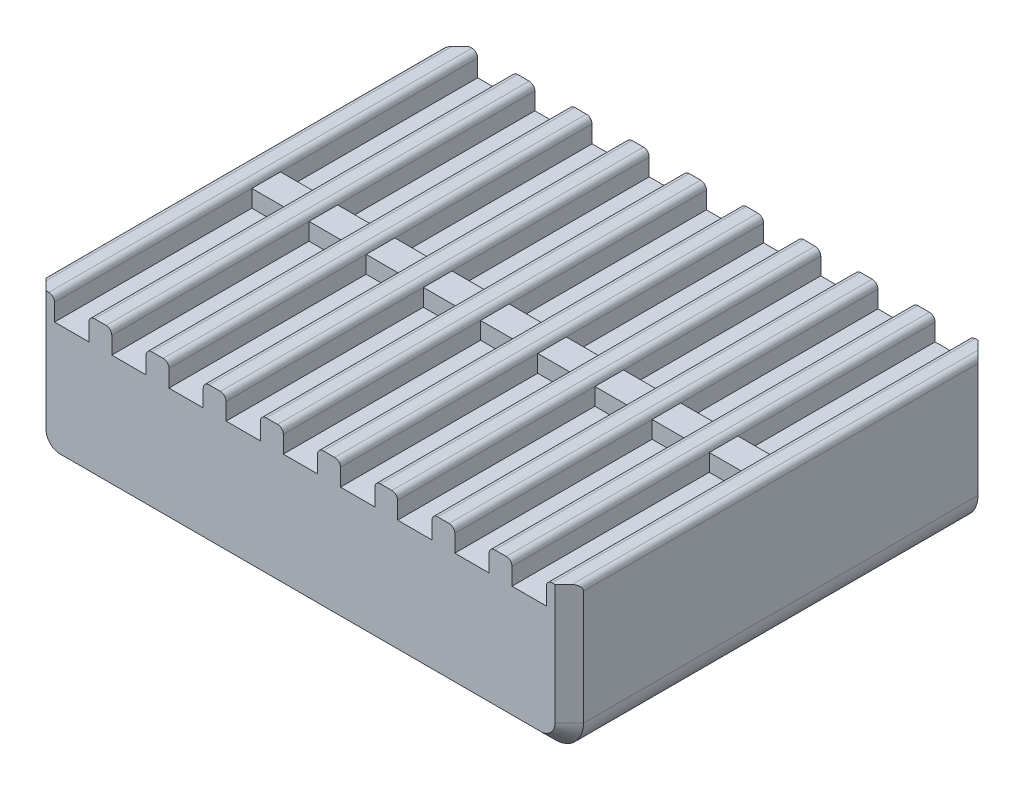
from build123d import *

# Parameters (mm, degrees)
SKETCH1_W           = 18.8
SKETCH1_H           = 14.8
BOSS_EXTRUDE1_DEPTH = 5.2
SKETCH2_W           = 1.2
SKETCH2_H           = 0.8
CUT_EXTRUDE1_DEPTH  = 19.287700785
SKETCH3_W           = 1.2
SKETCH3_H           = 0.8
CUT_EXTRUDE2_DEPTH  = 19.287700785
SKETCH4_W           = 1.2
SKETCH4_H           = 0.8
CUT_EXTRUDE3_DEPTH  = 19.287700785
SKETCH5_W           = 1.2
SKETCH5_H           = 0.8
CUT_EXTRUDE4_DEPTH  = 19.287700785
SKETCH6_W           = 1.2
SKETCH6_H           = 0.8
CUT_EXTRUDE5_DEPTH  = 19.287700785
SKETCH7_W           = 1.2
SKETCH7_H           = 0.8
CUT_EXTRUDE6_DEPTH  = 19.287700785
SKETCH8_W           = 1.2
SKETCH8_H           = 0.8
CUT_EXTRUDE7_DEPTH  = 19.287700785
SKETCH9_W           = 1.2
SKETCH9_H           = 0.8
CUT_EXTRUDE8_DEPTH  = 19.287700785
SKETCH10_W          = 1.2
SKETCH10_H          = 0.8
CUT_EXTRUDE9_DEPTH  = 19.287700785
RIB1_REACH          = 15.045
SKETCH11_WALL_W     = 29.289078174
SKETCH11_WALL_H     = 1
RIB2_REACH          = 15.045
SKETCH12_WALL_W     = 29.289078174
SKETCH12_WALL_H     = 1
RIB3_REACH          = 15.045
SKETCH13_WALL_W     = 29.289078174
SKETCH13_WALL_H     = 1
RIB4_REACH          = 15.045
SKETCH14_WALL_W     = 29.289078174
SKETCH14_WALL_H     = 1
RIB5_REACH          = 15.045
SKETCH15_WALL_W     = 29.289078174
SKETCH15_WALL_H     = 1
RIB6_REACH          = 15.045
SKETCH16_WALL_W     = 29.289078174
SKETCH16_WALL_H     = 1
RIB7_REACH          = 15.045
SKETCH17_WALL_W     = 29.289078174
SKETCH17_WALL_H     = 1
RIB8_REACH          = 15.045
SKETCH18_WALL_W     = 29.289078174
SKETCH18_WALL_H     = 1
RIB9_REACH          = 15.045
SKETCH19_WALL_W     = 29.289078174
SKETCH19_WALL_H     = 1
FILLET1_R           = 1
CHAMFER1_SIZE       = 0.5
FILLET2_START       = -8
FILLET2_DEPTH       = 16


with BuildPart() as part:
    # Sketch1 → Boss-Extrude1 (new body)
    with BuildSketch(Plane.XZ):
        Rectangle(SKETCH1_W, SKETCH1_H)
    extrude(amount=-BOSS_EXTRUDE1_DEPTH)

    # Sketch2 → Cut-Extrude1 (cut, through all)
    with BuildSketch(Plane(origin=(0, 0, -7.4), x_dir=(-1, 0, 0), z_dir=(0, 0, -1))):
        with Locations((-8, 4.8)):
            Rectangle(SKETCH2_W, SKETCH2_H)
    extrude(amount=-CUT_EXTRUDE1_DEPTH, mode=Mode.SUBTRACT)

    # Sketch3 → Cut-Extrude2 (cut, through all)
    with BuildSketch(Plane(origin=(0, 0, -7.4), x_dir=(-1, 0, 0), z_dir=(0, 0, -1))):
        with Locations((-6, 4.8)):
            Rectangle(SKETCH3_W, SKETCH3_H)
    extrude(amount=-CUT_EXTRUDE2_DEPTH, mode=Mode.SUBTRACT)

    # Sketch4 → Cut-Extrude3 (cut, through all)
    with BuildSketch(Plane(origin=(0, 0, -7.4), x_dir=(-1, 0, 0), z_dir=(0, 0, -1))):
        with Locations((-4, 4.8)):
            Rectangle(SKETCH4_W, SKETCH4_H)
    extrude(amount=-CUT_EXTRUDE3_DEPTH, mode=Mode.SUBTRACT)

    # Sketch5 → Cut-Extrude4 (cut, through all)
    with BuildSketch(Plane(origin=(0, 0, -7.4), x_dir=(-1, 0, 0), z_dir=(0, 0, -1))):
        with Locations((-2, 4.8)):
            Rectangle(SKETCH5_W, SKETCH5_H)
    extrude(amount=-CUT_EXTRUDE4_DEPTH, mode=Mode.SUBTRACT)

    # Sketch6 → Cut-Extrude5 (cut, through all)
    with BuildSketch(Plane(origin=(0, 0, -7.4), x_dir=(-1, 0, 0), z_dir=(0, 0, -1))):
        with Locations((0, 4.8)):
            Rectangle(SKETCH6_W, SKETCH6_H)
    extrude(amount=-CUT_EXTRUDE5_DEPTH, mode=Mode.SUBTRACT)

    # Sketch7 → Cut-Extrude6 (cut, through all)
    with BuildSketch(Plane(origin=(0, 0, -7.4), x_dir=(-1, 0, 0), z_dir=(0, 0, -1))):
        with Locations((2, 4.8)):
            Rectangle(SKETCH7_W, SKETCH7_H)
    extrude(amount=-CUT_EXTRUDE6_DEPTH, mode=Mode.SUBTRACT)

    # Sketch8 → Cut-Extrude7 (cut, through all)
    with BuildSketch(Plane(origin=(0, 0, -7.4), x_dir=(-1, 0, 0), z_dir=(0, 0, -1))):
        with Locations((4, 4.8)):
            Rectangle(SKETCH8_W, SKETCH8_H)
    extrude(amount=-CUT_EXTRUDE7_DEPTH, mode=Mode.SUBTRACT)

    # Sketch9 → Cut-Extrude8 (cut, through all)
    with BuildSketch(Plane(origin=(0, 0, -7.4), x_dir=(-1, 0, 0), z_dir=(0, 0, -1))):
        with Locations((6, 4.8)):
            Rectangle(SKETCH9_W, SKETCH9_H)
    extrude(amount=-CUT_EXTRUDE8_DEPTH, mode=Mode.SUBTRACT)

    # Sketch10 → Cut-Extrude9 (cut, through all)
    with BuildSketch(Plane(origin=(0, 0, -7.4), x_dir=(-1, 0, 0), z_dir=(0, 0, -1))):
        with Locations((8, 4.8)):
            Rectangle(SKETCH10_W, SKETCH10_H)
    extrude(amount=-CUT_EXTRUDE9_DEPTH, mode=Mode.SUBTRACT)

    # Sketch11 wall → Rib1 (add, up to next)
    with BuildSketch(Plane(origin=(4, 5, 0), x_dir=(1, 0, 0), z_dir=(0, -1, 0)), mode=Mode.PRIVATE) as rib1_sk1:
        Rectangle(SKETCH11_WALL_W, SKETCH11_WALL_H)
    rib1_tool1 = extrude(rib1_sk1.sketch, amount=RIB1_REACH, mode=Mode.PRIVATE) - part.part
    add(rib1_tool1.solids().sort_by_distance((4, 5, 0))[0])

    # Sketch12 wall → Rib2 (add, up to next)
    with BuildSketch(Plane(origin=(-4, 5, 0), x_dir=(1, 0, 0), z_dir=(0, -1, 0)), mode=Mode.PRIVATE) as rib2_sk1:
        Rectangle(SKETCH12_WALL_W, SKETCH12_WALL_H)
    rib2_tool1 = extrude(rib2_sk1.sketch, amount=RIB2_REACH, mode=Mode.PRIVATE) - part.part
    add(rib2_tool1.solids().sort_by_distance((-4, 5, 0))[0])

    # Sketch13 wall → Rib3 (add, up to next)
    with BuildSketch(Plane(origin=(-8, 5, 0), x_dir=(1, 0, 0), z_dir=(0, -1, 0)), mode=Mode.PRIVATE) as rib3_sk1:
        Rectangle(SKETCH13_WALL_W, SKETCH13_WALL_H)
    rib3_tool1 = extrude(rib3_sk1.sketch, amount=RIB3_REACH, mode=Mode.PRIVATE) - part.part
    add(rib3_tool1.solids().sort_by_distance((-8, 5, 0))[0])

    # Sketch14 wall → Rib4 (add, up to next)
    with BuildSketch(Plane(origin=(8, 5, 0), x_dir=(1, 0, 0), z_dir=(0, -1, 0)), mode=Mode.PRIVATE) as rib4_sk1:
        Rectangle(SKETCH14_WALL_W, SKETCH14_WALL_H)
    rib4_tool1 = extrude(rib4_sk1.sketch, amount=RIB4_REACH, mode=Mode.PRIVATE) - part.part
    add(rib4_tool1.solids().sort_by_distance((8, 5, 0))[0])

    # Sketch15 wall → Rib5 (add, up to next)
    with BuildSketch(Plane(origin=(2, 5, 0), x_dir=(1, 0, 0), z_dir=(0, -1, 0)), mode=Mode.PRIVATE) as rib5_sk1:
        Rectangle(SKETCH15_WALL_W, SKETCH15_WALL_H)
    rib5_tool1 = extrude(rib5_sk1.sketch, amount=RIB5_REACH, mode=Mode.PRIVATE) - part.part
    add(rib5_tool1.solids().sort_by_distance((2, 5, 0))[0])

    # Sketch16 wall → Rib6 (add, up to next)
    with BuildSketch(Plane(origin=(-2, 5, 0), x_dir=(1, 0, 0), z_dir=(0, -1, 0)), mode=Mode.PRIVATE) as rib6_sk1:
        Rectangle(SKETCH16_WALL_W, SKETCH16_WALL_H)
    rib6_tool1 = extrude(rib6_sk1.sketch, amount=RIB6_REACH, mode=Mode.PRIVATE) - part.part
    add(rib6_tool1.solids().sort_by_distance((-2, 5, 0))[0])

    # Sketch17 wall → Rib7 (add, up to next)
    with BuildSketch(Plane(origin=(6, 5, 0), x_dir=(1, 0, 0), z_dir=(0, -1, 0)), mode=Mode.PRIVATE) as rib7_sk1:
        Rectangle(SKETCH17_WALL_W, SKETCH17_WALL_H)
    rib7_tool1 = extrude(rib7_sk1.sketch, amount=RIB7_REACH, mode=Mode.PRIVATE) - part.part
    add(rib7_tool1.solids().sort_by_distance((6, 5, 0))[0])

    # Sketch18 wall → Rib8 (add, up to next)
    with BuildSketch(Plane.XZ.offset(-5), mode=Mode.PRIVATE) as rib8_sk1:
        Rectangle(SKETCH18_WALL_W, SKETCH18_WALL_H)
    rib8_tool1 = extrude(rib8_sk1.sketch, amount=RIB8_REACH, mode=Mode.PRIVATE) - part.part
    add(rib8_tool1.solids().sort_by_distance((0, 5, 0))[0])

    # Sketch19 wall → Rib9 (add, up to next)
    with BuildSketch(Plane(origin=(-6, 5, 0), x_dir=(1, 0, 0), z_dir=(0, -1, 0)), mode=Mode.PRIVATE) as rib9_sk1:
        Rectangle(SKETCH19_WALL_W, SKETCH19_WALL_H)
    rib9_tool1 = extrude(rib9_sk1.sketch, amount=RIB9_REACH, mode=Mode.PRIVATE) - part.part
    add(rib9_tool1.solids().sort_by_distance((-6, 5, 0))[0])

    # Fillet1
    fillet1_edges = [part.edges().sort_by_distance(p)[0] for p in [
        (9.4, 0, 0),
        (-9.4, 0, 0),
    ]]
    fillet(fillet1_edges, radius=FILLET1_R)

    # Chamfer1
    chamfer1_edges = [part.edges().sort_by_distance(p)[0] for p in [
        (-9.4, 3.1, 7.4),
        (9.4, 3.1, 7.4),
        (9.4, 3.1, -7.4),
        (-9.4, 3.1, -7.4),
        (0, 0, -7.4),
        (0, 0, 7.4),
        (-9.107106781, 0.292893219, 7.4),
        (9.107106781, 0.292893219, 7.4),
        (-9.107106781, 0.292893219, -7.4),
        (9.107106781, 0.292893219, -7.4),
    ]]
    chamfer(chamfer1_edges, length=CHAMFER1_SIZE)

    # Fillet2: read off the stored shape, not the designer's step
    # Fillet2 outline → Fillet2 (cut)
    with BuildSketch(Plane.XY.offset(FILLET2_START)):
        with BuildLine():
            Line((7.4, 5.2), (7.2, 5.2))
            ThreePointArc((7.2, 5.2), (7.341421356, 5.141421356), (7.4, 5))
            Line((7.4, 5), (7.4, 5.2))
        make_face()
        with BuildLine():
            ThreePointArc((6.6, 5), (6.658578644, 5.141421356), (6.8, 5.2))
            Line((6.8, 5.2), (6.6, 5.2))
            Line((6.6, 5.2), (6.6, 5))
        make_face()
        with BuildLine():
            Line((3.4, 5.2), (3.2, 5.2))
            ThreePointArc((3.2, 5.2), (3.341421356, 5.141421356), (3.4, 5))
            Line((3.4, 5), (3.4, 5.2))
        make_face()
        with BuildLine():
            ThreePointArc((2.6, 5), (2.658578644, 5.141421356), (2.8, 5.2))
            Line((2.8, 5.2), (2.6, 5.2))
            Line((2.6, 5.2), (2.6, 5))
        make_face()
        with BuildLine():
            Line((1.4, 5.2), (1.2, 5.2))
            ThreePointArc((1.2, 5.2), (1.341421356, 5.141421356), (1.4, 5))
            Line((1.4, 5), (1.4, 5.2))
        make_face()
        with BuildLine():
            ThreePointArc((0.6, 5), (0.658578644, 5.141421356), (0.8, 5.2))
            Line((0.8, 5.2), (0.6, 5.2))
            Line((0.6, 5.2), (0.6, 5))
        make_face()
        with BuildLine():
            Line((-7.4, 5.2), (-7.4, 5))
            ThreePointArc((-7.4, 5), (-7.341421356, 5.141421356), (-7.2, 5.2))
            Line((-7.2, 5.2), (-7.4, 5.2))
        make_face()
        with BuildLine():
            Line((-6.6, 5.2), (-6.8, 5.2))
            ThreePointArc((-6.8, 5.2), (-6.658578644, 5.141421356), (-6.6, 5))
            Line((-6.6, 5), (-6.6, 5.2))
        make_face()
        with BuildLine():
            Line((5.4, 5.2), (5.2, 5.2))
            ThreePointArc((5.2, 5.2), (5.341421356, 5.141421356), (5.4, 5))
            Line((5.4, 5), (5.4, 5.2))
        make_face()
        with BuildLine():
            ThreePointArc((4.6, 5), (4.658578644, 5.141421356), (4.8, 5.2))
            Line((4.8, 5.2), (4.6, 5.2))
            Line((4.6, 5.2), (4.6, 5))
        make_face()
        with BuildLine():
            Line((-8.6, 5.2), (-8.8, 5.2))
            ThreePointArc((-8.8, 5.2), (-8.658578644, 5.141421356), (-8.6, 5))
            Line((-8.6, 5), (-8.6, 5.2))
        make_face()
        with BuildLine():
            ThreePointArc((-9.4, 5), (-9.341421356, 5.141421356), (-9.2, 5.2))
            Line((-9.2, 5.2), (-9.4, 5.2))
            Line((-9.4, 5.2), (-9.4, 5))
        make_face()
        with BuildLine():
            Line((-5.4, 5.2), (-5.4, 5))
            ThreePointArc((-5.4, 5), (-5.341421356, 5.141421356), (-5.2, 5.2))
            Line((-5.2, 5.2), (-5.4, 5.2))
        make_face()
        with BuildLine():
            Line((-4.6, 5.2), (-4.8, 5.2))
            ThreePointArc((-4.8, 5.2), (-4.658578644, 5.141421356), (-4.6, 5))
            Line((-4.6, 5), (-4.6, 5.2))
        make_face()
        with BuildLine():
            Line((-3.4, 5.2), (-3.4, 5))
            ThreePointArc((-3.4, 5), (-3.341421356, 5.141421356), (-3.2, 5.2))
            Line((-3.2, 5.2), (-3.4, 5.2))
        make_face()
        with BuildLine():
            Line((-2.6, 5.2), (-2.8, 5.2))
            ThreePointArc((-2.8, 5.2), (-2.658578644, 5.141421356), (-2.6, 5))
            Line((-2.6, 5), (-2.6, 5.2))
        make_face()
        with BuildLine():
            Line((-1.4, 5.2), (-1.4, 5))
            ThreePointArc((-1.4, 5), (-1.341421356, 5.141421356), (-1.2, 5.2))
            Line((-1.2, 5.2), (-1.4, 5.2))
        make_face()
        with BuildLine():
            Line((-0.6, 5.2), (-0.8, 5.2))
            ThreePointArc((-0.8, 5.2), (-0.658578644, 5.141421356), (-0.6, 5))
            Line((-0.6, 5), (-0.6, 5.2))
        make_face()
        with BuildLine():
            Line((8.6, 5.2), (8.6, 5))
            ThreePointArc((8.6, 5), (8.658578644, 5.141421356), (8.8, 5.2))
            Line((8.8, 5.2), (8.6, 5.2))
        make_face()
        with BuildLine():
            Line((9.4, 5.2), (9.2, 5.2))
            ThreePointArc((9.2, 5.2), (9.341421356, 5.141421356), (9.4, 5))
            Line((9.4, 5), (9.4, 5.2))
        make_face()
    extrude(amount=FILLET2_DEPTH, mode=Mode.SUBTRACT)


solid = part.part
